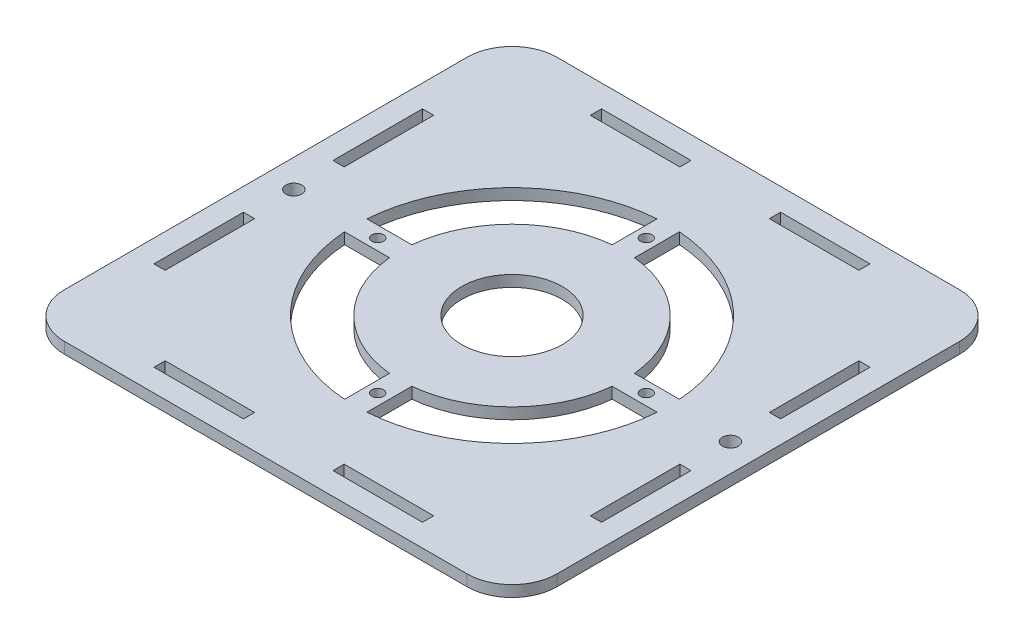
from build123d import *

# Parameters (mm, degrees)
SKETCH1_W                 = 139.7
SKETCH1_H                 = 139.7
BOSS_EXTRUDE1_DEPTH       = 3.175
SKETCH13_W                = 25.4
SKETCH13_H                = 3.175
CUT_EXTRUDE6_DEPTH        = 6.35
LPATTERN7_COUNT           = 2
LPATTERN7_PITCH           = 123.825
SKETCH14_W                = 3.175
SKETCH14_H                = 25.4
CUT_EXTRUDE7_DEPTH        = 6.35
F_8_CLEARANCE_HOLE1_D     = 4.4958
F_8_CLEARANCE_HOLE1_DEPTH = 10.16
F_8_CLEARANCE_HOLE1_TIP   = 1.350674586
SKETCH18_R                = 14.2875
CUT_EXTRUDE9_DEPTH        = 7.62
FILLET6_R                 = 12.7
CUT_EXTRUDE17_DEPTH       = 7.62
CIRPATTERN1_COUNT         = 4


with BuildPart() as part:
    # Sketch1 → Boss-Extrude1 (new body)
    with BuildSketch(Plane(origin=(0, 0, 0), x_dir=(1, 0, 0), z_dir=(0, 1, 0))):
        with Locations((69.85, 69.85)):
            Rectangle(SKETCH1_W, SKETCH1_H)
    extrude(amount=BOSS_EXTRUDE1_DEPTH)

    # Sketch13 → Cut-Extrude6 (cut)
    with BuildSketch(Plane(origin=(0, 3.175, 0), x_dir=(1, 0, 0), z_dir=(0, 1, 0))):
        with Locations((44.45, 7.9375)):
            Rectangle(SKETCH13_W, SKETCH13_H)
        with Locations((95.25, 7.9375)):
            Rectangle(SKETCH13_W, SKETCH13_H)
    cut_extrude6 = extrude(amount=-CUT_EXTRUDE6_DEPTH, mode=Mode.SUBTRACT)

    # LPattern7: Cut-Extrude6 ×2
    with Locations(*[(0, 0, -i * LPATTERN7_PITCH) for i in range(1, LPATTERN7_COUNT)]):
        add(cut_extrude6, mode=Mode.SUBTRACT)

    # Sketch14 → Cut-Extrude7 (cut)
    with BuildSketch(Plane(origin=(0, 3.175, 0), x_dir=(1, 0, 0), z_dir=(0, 1, 0))):
        with Locations((7.9375, 44.45)):
            Rectangle(SKETCH14_W, SKETCH14_H)
        with Locations((131.7625, 44.45)):
            Rectangle(SKETCH14_W, SKETCH14_H)
        with Locations((131.7625, 95.25)):
            Rectangle(SKETCH14_W, SKETCH14_H)
        with Locations((7.9375, 95.25)):
            Rectangle(SKETCH14_W, SKETCH14_H)
    extrude(amount=-CUT_EXTRUDE7_DEPTH, mode=Mode.SUBTRACT)

    # #8 Clearance Hole1
    with Locations(Plane(origin=(0, 3.175, 0), x_dir=(1, 0, 0), z_dir=(0, 1, 0))):
        with Locations((7.9375, 69.85), (131.826, 69.85)):
            Hole(F_8_CLEARANCE_HOLE1_D / 2, depth=F_8_CLEARANCE_HOLE1_DEPTH)
            with Locations((0, 0, -(F_8_CLEARANCE_HOLE1_DEPTH + F_8_CLEARANCE_HOLE1_TIP / 2))):  # 118° drill point
                Cone(0, F_8_CLEARANCE_HOLE1_D / 2, F_8_CLEARANCE_HOLE1_TIP, mode=Mode.SUBTRACT)

    # Sketch18 → Cut-Extrude9 (cut)
    with BuildSketch(Plane(origin=(0, 3.175, 0), x_dir=(1, 0, 0), z_dir=(0, 1, 0))):
        with Locations((69.85, 69.85)):
            Circle(SKETCH18_R)
    extrude(amount=-CUT_EXTRUDE9_DEPTH, mode=Mode.SUBTRACT)

    # Fillet6
    fillet6_edges = [part.edges().sort_by_distance(p)[0] for p in [
        (139.7, 1.5875, -139.7),
        (139.7, 1.5875, 0),
        (0, 1.5875, 0),
        (0, 1.5875, -139.7),
    ]]
    fillet(fillet6_edges, radius=FILLET6_R)

    # Sketch26 → Cut-Extrude17 (cut)
    with BuildSketch(Plane(origin=(0, 3.175, 0), x_dir=(1, 0, 0), z_dir=(0, 1, 0))):
        with BuildLine():
            ThreePointArc((25.513537861, 66.675), (38.419103576, 38.419103576), (66.675, 25.513537861))
            Line((66.675, 25.513537861), (66.675, 38.259148872))
            ThreePointArc((66.675, 38.259148872), (47.399359697, 47.399359697), (38.259148872, 66.675))
            Line((38.259148872, 66.675), (25.513537861, 66.675))
        make_face()
        with BuildLine():
            Line((73.025, 38.259148872), (73.025, 25.513537861))
            ThreePointArc((73.025, 25.513537861), (101.280896424, 38.419103576), (114.186462139, 66.675))
            Line((114.186462139, 66.675), (101.440851128, 66.675))
            ThreePointArc((101.440851128, 66.675), (92.300640303, 47.399359697), (73.025, 38.259148872))
        make_face()
        with BuildLine():
            ThreePointArc((66.675, 114.186462139), (38.419103576, 101.280896424), (25.513537861, 73.025))
            Line((25.513537861, 73.025), (38.259148872, 73.025))
            ThreePointArc((38.259148872, 73.025), (47.399359697, 92.300640303), (66.675, 101.440851128))
            Line((66.675, 101.440851128), (66.675, 114.186462139))
        make_face()
        with BuildLine():
            Line((101.440851128, 73.025), (114.186462139, 73.025))
            ThreePointArc((114.186462139, 73.025), (101.280896424, 101.280896424), (73.025, 114.186462139))
            Line((73.025, 114.186462139), (73.025, 101.440851128))
            ThreePointArc((73.025, 101.440851128), (92.300640303, 92.300640303), (101.440851128, 73.025))
        make_face()
    extrude(amount=-CUT_EXTRUDE17_DEPTH, mode=Mode.SUBTRACT)

    # Sketch27 → #4 Clearance Hole1 (revolve, cut)
    with BuildSketch(Plane(origin=(69.85, 3.175, -107.95), x_dir=(0, 0, 1), z_dir=(1, 0, 0))):
        Polygon((0, 0), (0, 11.140574487), (1.63195, 10.16), (1.63195, 0), align=None)
    f_4_clearance_hole1 = revolve(axis=Axis((69.85, 9.525, -107.95), (0, -1, 0)), mode=Mode.SUBTRACT)

    # CirPattern1: #4 Clearance Hole1 ×4 about axis
    cirpattern1_axis = Axis((69.85, 3.175, -69.85), (0, 1, 0))
    for i in range(1, CIRPATTERN1_COUNT):
        add(f_4_clearance_hole1.rotate(cirpattern1_axis, i * 360 / CIRPATTERN1_COUNT), mode=Mode.SUBTRACT)


solid = part.part
